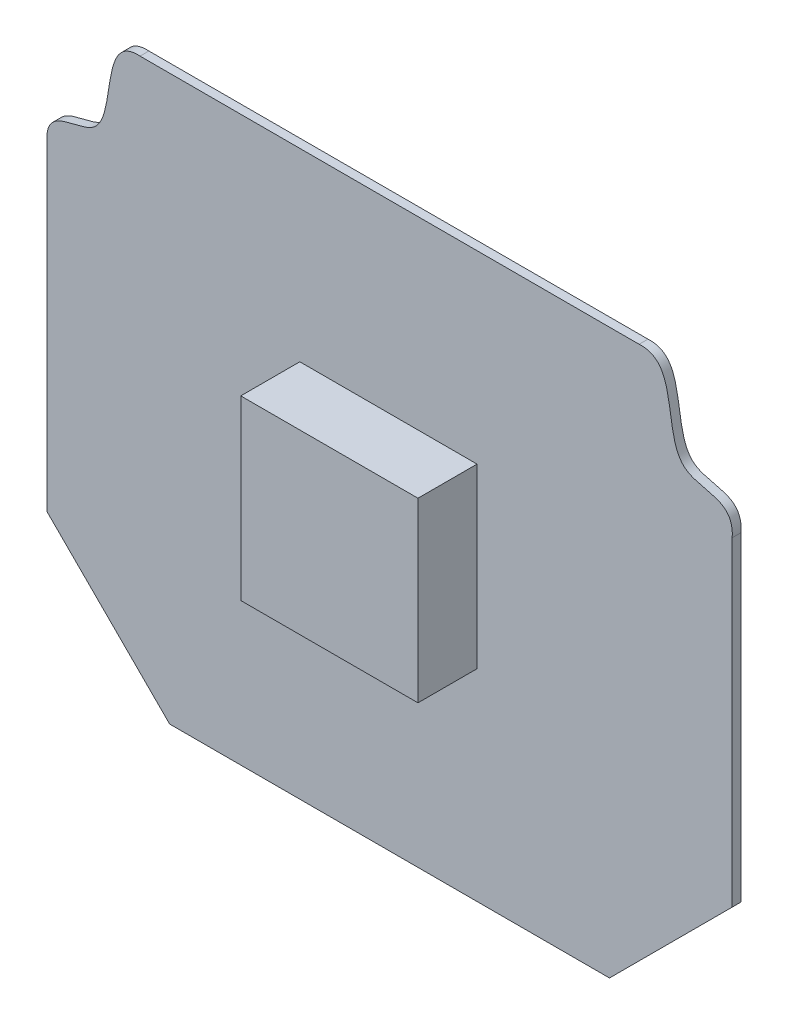
from build123d import *

# Parameters (mm, degrees)
DODANIE_WYCI_GNI_CIE1_DEPTH      = 1.5
DODANIE_WYCI_GNI_CIE2_DEPTH      = 10
DODANIE_WYCI_GNI_CIE2_DEPTH_BACK = 11.5
SZKIC2_W                         = 30
SZKIC2_H                         = 30


with BuildPart() as part:
    # Szkic1 → Dodanie-wyciągnięcie1 (new body)
    with BuildSketch(Plane.XY):
        with BuildLine():
            Line((-102.239752222, 144.54202104), (-17.760247778, 144.54202104))
            add(Edge.make_bspline(
                [(-2, 124.044101896), (-1.592986833, 129.772442377), (-16.023217227, 125.765984909), (-10.76975246, 144.982690498), (-17.760247778, 144.54202104)],
                knots=[0, 0, 0, 0, 0.400933177, 1, 1, 1, 1], degree=3))
            Line((-2, 124.044101896), (-2, 69.895252157))
            Line((-2, 69.895252157), (-22.770828778, 49.124423379))
            Line((-22.770828778, 49.124423379), (-97.229171222, 49.124423379))
            Line((-97.229171222, 49.124423379), (-118, 69.895252157))
            Line((-118, 69.895252157), (-118, 124.044101896))
            add(Edge.make_bspline(
                [(-118, 124.044101896), (-118.407013167, 129.772442377), (-103.976782773, 125.765984909), (-109.23024754, 144.982690498), (-102.239752222, 144.54202104)],
                knots=[0, 0, 0, 0, 0.400933177, 1, 1, 1, 1], degree=3))
        make_face()
    extrude(amount=DODANIE_WYCI_GNI_CIE1_DEPTH)

    # Szkic2 → Dodanie-wyciągnięcie2 (add, two sides: drawn at the far end of the back side and taken through both)
    with BuildSketch(Plane.XY.offset(1.5).offset(-DODANIE_WYCI_GNI_CIE2_DEPTH_BACK)):
        with Locations((-60.192549349, 98.253962929)):
            Rectangle(SZKIC2_W, SZKIC2_H)
    extrude(amount=DODANIE_WYCI_GNI_CIE2_DEPTH + DODANIE_WYCI_GNI_CIE2_DEPTH_BACK)


solid = part.part
